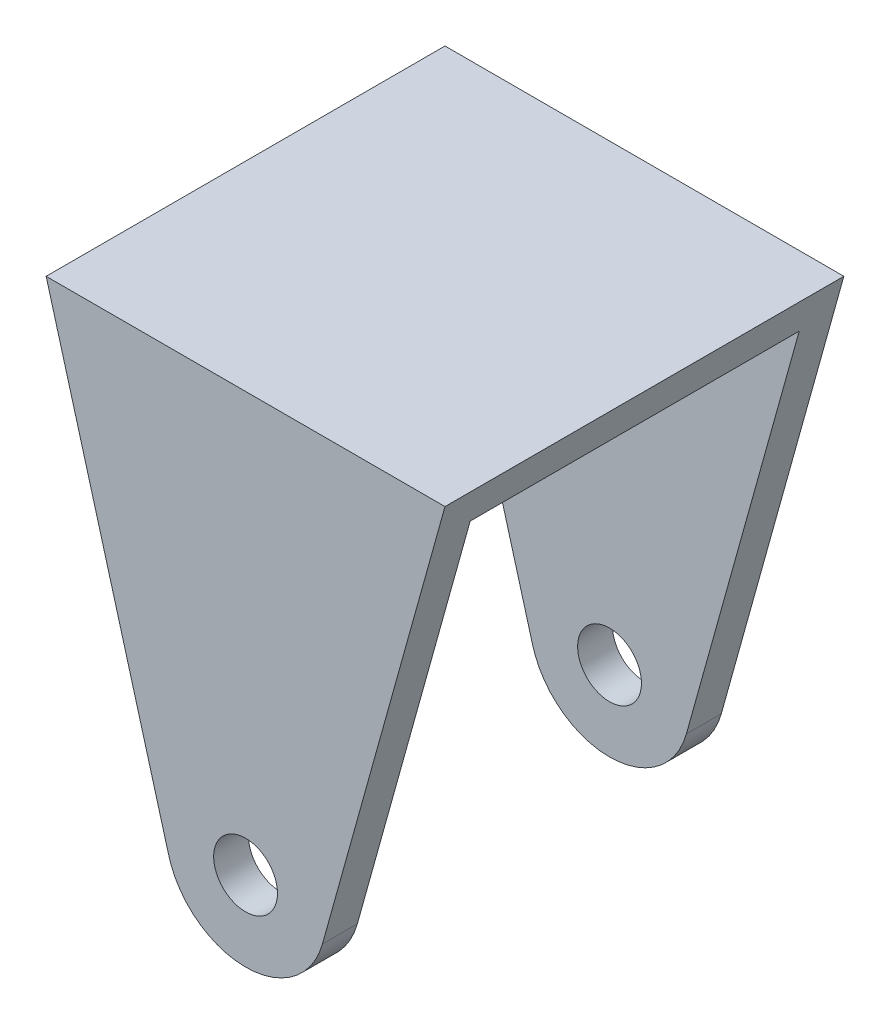
from build123d import *

# Parameters (mm, degrees)
SKETCH1_R               = 5.5
SKETCH1_R_2             = 3
BOSS_EXTRUDE1_DEPTH     = 30
BOSS_EXTRUDE2_START     = -5
BOSS_EXTRUDE2_DEPTH     = 40
CUT_EXTRUDE1_DEPTH      = 59.215118311
CUT_EXTRUDE1_DEPTH_BACK = 59.215118311
SKETCH3_W               = 33
SKETCH3_H               = 46.5
CUT_EXTRUDE2_DEPTH      = 62.351446601
CUT_EXTRUDE2_DEPTH_BACK = 62.351446601
SKETCH4_R               = 3.2


with BuildPart() as part:
    # Sketch1 → Boss-Extrude1 (new body)
    with BuildSketch(Plane.XY):
        Circle(SKETCH1_R)
        Circle(SKETCH1_R_2, mode=Mode.SUBTRACT)
    extrude(amount=BOSS_EXTRUDE1_DEPTH)

    # Sketch2 → Boss-Extrude2 (add)
    with BuildSketch(Plane.XY.offset(BOSS_EXTRUDE2_START)):
        with BuildLine():
            Line((7.706771874, -2.146081845), (20, 42))
            Line((20, 42), (-20, 42))
            Line((-20, 42), (-7.741214055, -2.018317358))
            ThreePointArc((-7.741214055, -2.018317358), (-0.066162731, -7.999726401), (7.706771874, -2.146081845))
        make_face()
    extrude(amount=BOSS_EXTRUDE2_DEPTH)

    # Sketch3 → Cut-Extrude1 (cut, two sides: drawn at the far end of the back side and taken through both)
    with BuildSketch(Plane(origin=(0, 0, 0), x_dir=(0, 0, -1), z_dir=(1, 0, 0)).offset(-CUT_EXTRUDE1_DEPTH_BACK)):
        with Locations((-15, 15.25)):
            Rectangle(SKETCH3_W, SKETCH3_H)
    extrude(amount=CUT_EXTRUDE1_DEPTH + CUT_EXTRUDE1_DEPTH_BACK, mode=Mode.SUBTRACT)

    # Sketch4 → Cut-Extrude2 (cut, two sides: drawn at the far end of the back side and taken through both)
    with BuildSketch(Plane.XY.offset(35).offset(-CUT_EXTRUDE2_DEPTH_BACK)):
        Circle(SKETCH4_R)
    extrude(amount=CUT_EXTRUDE2_DEPTH + CUT_EXTRUDE2_DEPTH_BACK, mode=Mode.SUBTRACT)


solid = part.part
